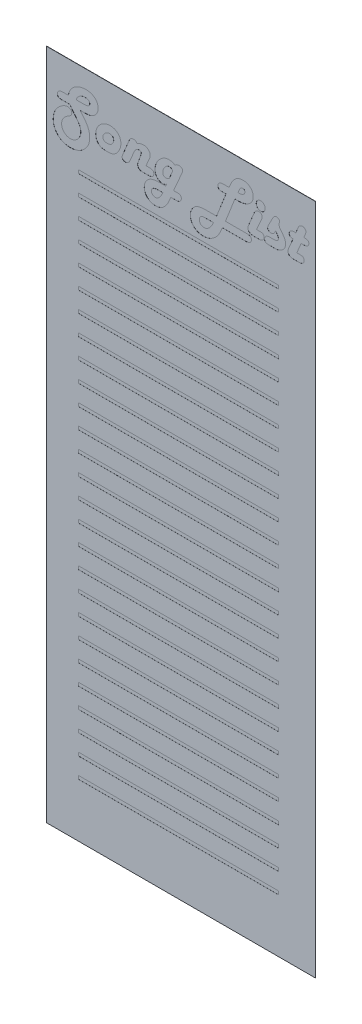
from build123d import *

# Parameters (mm, degrees)
SKETCH1_W           = 101.6
SKETCH1_H           = 254
BOSS_EXTRUDE1_DEPTH = 0.0762
SKETCH2_W           = 75.543719092
SKETCH2_H           = 1.27
CUT_EXTRUDE1_DEPTH  = 0.0254


with BuildPart() as part:
    # Sketch1 → Boss-Extrude1 (new body)
    with BuildSketch(Plane.XY):
        with Locations((50.8, 127)):
            Rectangle(SKETCH1_W, SKETCH1_H)
    extrude(amount=BOSS_EXTRUDE1_DEPTH)

    # Sketch2 → Cut-Extrude1 (cut)
    # profile 1 of 36: a face of its own
    with BuildSketch(Plane.XY.offset(0.0762)):
        with Locations((49.933239824, 211.380323937)):
            Rectangle(SKETCH2_W, SKETCH2_H)
    # profile 2 of 36: a face of its own
    with BuildSketch(Plane.XY.offset(0.0762)):
        with Locations((49.933239824, 219.000323937)):
            Rectangle(SKETCH2_W, SKETCH2_H)
    # profile 3 of 36: a face of its own
    with BuildSketch(Plane.XY.offset(0.0762)):
        with Locations((49.933239824, 203.760323937)):
            Rectangle(SKETCH2_W, SKETCH2_H)
    # profile 4 of 36: a face of its own
    with BuildSketch(Plane.XY.offset(0.0762)):
        with Locations((49.933239824, 196.140323937)):
            Rectangle(SKETCH2_W, SKETCH2_H)
    # profile 5 of 36: a face of its own
    with BuildSketch(Plane.XY.offset(0.0762)):
        with Locations((49.933239824, 188.520323937)):
            Rectangle(SKETCH2_W, SKETCH2_H)
    # profile 6 of 36: a face of its own
    with BuildSketch(Plane.XY.offset(0.0762)):
        with Locations((49.933239824, 180.900323937)):
            Rectangle(SKETCH2_W, SKETCH2_H)
    # profile 7 of 36: a face of its own
    with BuildSketch(Plane.XY.offset(0.0762)):
        with Locations((49.933239824, 173.280323937)):
            Rectangle(SKETCH2_W, SKETCH2_H)
    # profile 8 of 36: a face of its own
    with BuildSketch(Plane.XY.offset(0.0762)):
        with Locations((49.933239824, 165.660323937)):
            Rectangle(SKETCH2_W, SKETCH2_H)
    # profile 9 of 36: a face of its own
    with BuildSketch(Plane.XY.offset(0.0762)):
        with Locations((49.933239824, 158.040323937)):
            Rectangle(SKETCH2_W, SKETCH2_H)
    # profile 10 of 36: a face of its own
    with BuildSketch(Plane.XY.offset(0.0762)):
        with Locations((49.933239824, 150.420323937)):
            Rectangle(SKETCH2_W, SKETCH2_H)
    # profile 11 of 36: a face of its own
    with BuildSketch(Plane.XY.offset(0.0762)):
        with Locations((49.933239824, 142.800323937)):
            Rectangle(SKETCH2_W, SKETCH2_H)
    # profile 12 of 36: a face of its own
    with BuildSketch(Plane.XY.offset(0.0762)):
        with Locations((49.933239824, 135.180323937)):
            Rectangle(SKETCH2_W, SKETCH2_H)
    # profile 13 of 36: a face of its own
    with BuildSketch(Plane.XY.offset(0.0762)):
        with Locations((49.933239824, 127.560323937)):
            Rectangle(SKETCH2_W, SKETCH2_H)
    # profile 14 of 36: a face of its own
    with BuildSketch(Plane.XY.offset(0.0762)):
        with Locations((49.933239824, 119.940323937)):
            Rectangle(SKETCH2_W, SKETCH2_H)
    # profile 15 of 36: a face of its own
    with BuildSketch(Plane.XY.offset(0.0762)):
        with Locations((49.933239824, 112.320323937)):
            Rectangle(SKETCH2_W, SKETCH2_H)
    # profile 16 of 36: a face of its own
    with BuildSketch(Plane.XY.offset(0.0762)):
        with Locations((49.933239824, 104.700323937)):
            Rectangle(SKETCH2_W, SKETCH2_H)
    # profile 17 of 36: a face of its own
    with BuildSketch(Plane.XY.offset(0.0762)):
        with Locations((49.933239824, 97.080323937)):
            Rectangle(SKETCH2_W, SKETCH2_H)
    # profile 18 of 36: a face of its own
    with BuildSketch(Plane.XY.offset(0.0762)):
        with Locations((49.933239824, 89.460323937)):
            Rectangle(SKETCH2_W, SKETCH2_H)
    # profile 19 of 36: a face of its own
    with BuildSketch(Plane.XY.offset(0.0762)):
        with Locations((49.933239824, 81.840323937)):
            Rectangle(SKETCH2_W, SKETCH2_H)
    # profile 20 of 36: a face of its own
    with BuildSketch(Plane.XY.offset(0.0762)):
        with Locations((49.933239824, 74.220323937)):
            Rectangle(SKETCH2_W, SKETCH2_H)
    # profile 21 of 36: a face of its own
    with BuildSketch(Plane.XY.offset(0.0762)):
        with Locations((49.933239824, 66.600323937)):
            Rectangle(SKETCH2_W, SKETCH2_H)
    # profile 22 of 36: a face of its own
    with BuildSketch(Plane.XY.offset(0.0762)):
        with Locations((49.933239824, 58.980323937)):
            Rectangle(SKETCH2_W, SKETCH2_H)
    # profile 23 of 36: a face of its own
    with BuildSketch(Plane.XY.offset(0.0762)):
        with Locations((49.933239824, 51.360323937)):
            Rectangle(SKETCH2_W, SKETCH2_H)
    # profile 24 of 36: a face of its own
    with BuildSketch(Plane.XY.offset(0.0762)):
        with Locations((49.933239824, 43.740323937)):
            Rectangle(SKETCH2_W, SKETCH2_H)
    # profile 25 of 36: a face of its own
    with BuildSketch(Plane.XY.offset(0.0762)):
        with Locations((49.933239824, 36.120323937)):
            Rectangle(SKETCH2_W, SKETCH2_H)
    # profile 26 of 36: a face of its own
    with BuildSketch(Plane.XY.offset(0.0762)):
        with Locations((49.933239824, 28.500323937)):
            Rectangle(SKETCH2_W, SKETCH2_H)
    # profile 27 of 36: a face of its own
    with BuildSketch(Plane.XY.offset(0.0762)):
        with Locations((49.933239824, 20.880323937)):
            Rectangle(SKETCH2_W, SKETCH2_H)
    # profile 28 of 36: a face of its own
    with BuildSketch(Plane.XY.offset(0.0762)):
        with BuildLine():
            Line((12.799992108, 239.347419693), (13.899009659, 237.940959933))
            Line((13.899009659, 237.940959933), (14.531563169, 237.163519864))
            add(Edge.make_bspline(
                [(14.531563169, 237.163519864), (14.678267375, 236.972488698), (14.966937966, 236.596595728), (15.341376369, 236.00534523), (15.656433521, 235.404998945), (15.921631391, 234.799679598), (16.124086339, 234.183089813), (16.263229041, 233.557847822), (16.357860953, 232.925814207), (16.367729024, 232.500400005), (16.372682604, 232.286850344)],
                knots=[0, 0, 0, 0, 1.087213536, 2.139315444, 3.155259872, 4.146323933, 5.120225414, 6.080243713, 7.036319657, 8, 8, 8, 8], degree=3))
            add(Edge.make_bspline(
                [(16.372682604, 232.286850344), (16.36835068, 232.081628828), (16.359779243, 231.675563631), (16.278818722, 231.07731083), (16.152316005, 230.498946919), (15.975109766, 229.939945184), (15.743474483, 229.401357422), (15.463554822, 228.8810116), (15.134359827, 228.37780816), (14.877393692, 228.066344202), (14.747126097, 227.908449231)],
                knots=[0, 0, 0, 0, 1.031153094, 2.040309392, 3.028753844, 4.004416457, 4.983308086, 5.971486458, 6.971656013, 8, 8, 8, 8], degree=3))
            add(Edge.make_bspline(
                [(14.747126097, 227.908449231), (14.559474132, 227.702655651), (14.188650196, 227.295981595), (13.562853793, 226.768524375), (12.893621284, 226.325005016), (12.18461878, 225.955196809), (11.429102808, 225.673553763), (10.63141938, 225.473450616), (9.792211357, 225.344215104), (9.217188401, 225.331648526), (8.923393221, 225.325227912)],
                knots=[0, 0, 0, 0, 1.014361963, 2.004507103, 2.973878053, 3.936004283, 4.912953146, 5.905404457, 6.929813031, 8, 8, 8, 8], degree=3))
            add(Edge.make_bspline(
                [(8.923393221, 225.325227912), (8.695783163, 225.330586942), (8.25084507, 225.341062914), (7.59942141, 225.425200226), (6.978564695, 225.556928265), (6.389469186, 225.749346641), (5.831575512, 225.993708141), (5.304353377, 226.292916), (4.808881631, 226.646571882), (4.351287515, 227.053390189), (3.934758885, 227.49896482), (3.572510547, 227.983243593), (3.263544099, 228.49664037), (3.011688666, 229.040528045), (2.814896346, 229.614697382), (2.680414374, 230.220534234), (2.591808109, 230.855408231), (2.581765966, 231.288828962), (2.576655207, 231.509410275)],
                knots=[0, 0, 0, 0, 1.098721128, 2.147808791, 3.166400415, 4.159305812, 5.134755567, 6.102713917, 7.081309491, 8.068545344, 9.054600725, 10.021555836, 10.983378149, 11.942775527, 12.91049988, 13.908118797, 14.935376481, 16, 16, 16, 16], degree=3))
            add(Edge.make_bspline(
                [(2.576655207, 231.509410275), (2.583732104, 231.780984107), (2.597669113, 232.315812697), (2.740046685, 233.097328056), (2.952290284, 233.848011406), (3.264621017, 234.560498261), (3.658131334, 235.242693645), (4.1486542, 235.881070282), (4.716272314, 236.494492826), (5.151948976, 236.857273335), (5.375439453, 237.043370035)],
                knots=[0, 0, 0, 0, 1.012350536, 1.993689918, 2.954908396, 3.917623185, 4.88865083, 5.88644935, 6.915805033, 8, 8, 8, 8], degree=3))
            add(Edge.make_bspline(
                [(5.375439453, 237.043370035), (5.496733976, 237.136924235), (5.731893152, 237.318301992), (6.094343574, 237.555002087), (6.447970287, 237.757598978), (6.794084679, 237.925855572), (7.13420728, 238.052961615), (7.466017161, 238.146517711), (7.791548927, 238.206734639), (8.007889496, 238.213349014), (8.114148786, 238.216597775)],
                knots=[0, 0, 0, 0, 1.211496243, 2.34878256, 3.421462773, 4.434344698, 5.389824246, 6.289742663, 7.159978495, 8, 8, 8, 8], degree=3))
            add(Edge.make_bspline(
                [(8.114148786, 238.216597775), (8.218256396, 238.21196152), (8.419612883, 238.202994453), (8.705954674, 238.130835935), (8.963801673, 238.014094014), (9.182002339, 237.84529301), (9.364246572, 237.646015371), (9.495177012, 237.411644564), (9.575472211, 237.149871027), (9.583587931, 236.965031236), (9.587751097, 236.870212929)],
                knots=[0, 0, 0, 0, 1.115149443, 2.156831516, 3.145864946, 4.128667034, 5.094848421, 6.022437604, 6.985558699, 8, 8, 8, 8], degree=3))
            add(Edge.make_bspline(
                [(9.587751097, 236.870212929), (9.58550612, 236.803909444), (9.581040153, 236.672010943), (9.530451369, 236.480345808), (9.462475512, 236.293541274), (9.354038702, 236.117511011), (9.22179856, 235.945278265), (9.056017311, 235.782534376), (8.864587284, 235.625965563), (8.721755469, 235.5330796), (8.647755378, 235.48495608)],
                knots=[0, 0, 0, 0, 0.905632309, 1.801587702, 2.70029788, 3.618768585, 4.619014936, 5.668392158, 6.792011483, 8, 8, 8, 8], degree=3))
            Line((8.647755378, 235.48495608), (7.683022929, 234.891274573))
            add(Edge.make_bspline(
                [(7.683022929, 234.891274573), (7.546888498, 234.79967489), (7.273602252, 234.615790964), (6.914212103, 234.266573449), (6.577798169, 233.879295172), (6.291561923, 233.440418898), (6.049254852, 232.984045289), (5.871706886, 232.518325149), (5.765428401, 232.053711901), (5.750355979, 231.743150104), (5.742956577, 231.590688101)],
                knots=[0, 0, 0, 0, 0.988432046, 1.984251009, 3.012924967, 4.079661629, 5.138575426, 6.126265742, 7.080140308, 8, 8, 8, 8], degree=3))
            add(Edge.make_bspline(
                [(5.742956577, 231.590688101), (5.745144047, 231.472701504), (5.749448962, 231.240505296), (5.798994476, 230.901763813), (5.866306886, 230.577436921), (5.971552264, 230.271736083), (6.101563389, 229.979236403), (6.265494048, 229.704990291), (6.453997164, 229.443100747), (6.671642339, 229.202371589), (6.911388781, 228.982654887), (7.17043711, 228.792340824), (7.44329156, 228.62638297), (7.735987878, 228.498554528), (8.039057001, 228.388168431), (8.36174836, 228.321632375), (8.69802291, 228.271621155), (8.929076985, 228.267479865), (9.047076868, 228.265364898)],
                knots=[0, 0, 0, 0, 1.077506836, 2.12052054, 3.123651777, 4.100793165, 5.069355656, 6.044299951, 7.015551488, 8.014281989, 9.005030209, 9.982645996, 10.948331918, 11.916894409, 12.897529089, 13.890147529, 14.922493164, 16, 16, 16, 16], degree=3))
            add(Edge.make_bspline(
                [(9.047076868, 228.265364898), (9.177993517, 228.270001439), (9.436326197, 228.279150541), (9.817493637, 228.334968771), (10.18241484, 228.43642139), (10.536763578, 228.570353316), (10.876227293, 228.748524942), (11.201641403, 228.965736381), (11.516273701, 229.21884143), (11.810968669, 229.509534051), (12.085418614, 229.823102992), (12.323225257, 230.157698216), (12.525684251, 230.505346316), (12.69349803, 230.866688017), (12.820558619, 231.243944258), (12.911640546, 231.633235952), (12.971598908, 232.036451798), (12.977311579, 232.310191303), (12.980216851, 232.449405994)],
                knots=[0, 0, 0, 0, 0.988079025, 1.949737506, 2.898492785, 3.84106555, 4.803175793, 5.784354068, 6.789399104, 7.845390096, 8.903996503, 9.930047073, 10.937761348, 11.936022923, 12.931073945, 13.935765168, 14.950199696, 16, 16, 16, 16], degree=3))
            add(Edge.make_bspline(
                [(12.980216851, 232.449405994), (12.975385663, 232.624164239), (12.965886816, 232.967765417), (12.87274566, 233.470436919), (12.730384477, 233.950124901), (12.554296121, 234.333594636), (12.373062179, 234.642897515), (12.207846763, 234.908337092), (12.004181181, 235.201584333), (11.768017155, 235.52520161), (11.498226595, 235.879843819), (11.194776241, 236.263357494), (10.858164709, 236.67828547), (10.620038426, 236.962433212), (10.49594245, 237.110512587)],
                knots=[0, 0, 0, 0, 1.162130439, 2.284924465, 3.391170218, 4.485879898, 5.083016391, 5.777003495, 6.566473729, 7.458843396, 8.44366613, 9.532293729, 10.71399153, 12, 12, 12, 12], degree=3))
            add(Edge.make_bspline(
                [(10.49594245, 237.110512587), (10.326272593, 237.314792217), (10.003608929, 237.703273798), (9.58147449, 238.284899781), (9.222364337, 238.819773789), (9.035941939, 239.17846336), (8.94812995, 239.347419693)],
                knots=[0, 0, 0, 0, 1.168433099, 2.222026432, 3.162507306, 4, 4, 4, 4], degree=3))
            Line((8.94812995, 239.347419693), (5.728821303, 239.347419693))
            add(Edge.make_bspline(
                [(5.728821303, 239.347419693), (5.606135129, 239.350665327), (5.376125333, 239.356750183), (5.053769465, 239.404748764), (4.779414333, 239.486918331), (4.552231497, 239.604992954), (4.371587404, 239.758289821), (4.249824992, 239.954232608), (4.171823794, 240.179213412), (4.163925107, 240.340909035), (4.159805892, 240.425234333)],
                knots=[0, 0, 0, 0, 1.363150398, 2.555609448, 3.611533672, 4.531061041, 5.384561123, 6.208947295, 7.065954584, 8, 8, 8, 8], degree=3))
            add(Edge.make_bspline(
                [(4.159805892, 240.425234333), (4.165762438, 240.549824178), (4.177183795, 240.788718524), (4.287601344, 241.122832807), (4.464402085, 241.412448641), (4.717018168, 241.648241297), (5.028758082, 241.836187227), (5.399425719, 241.970198624), (5.825926192, 242.045475878), (6.127833879, 242.05589411), (6.287164625, 242.061392296)],
                knots=[0, 0, 0, 0, 0.982763483, 1.884396285, 2.750572256, 3.640234128, 4.589429985, 5.612361548, 6.739932005, 8, 8, 8, 8], degree=3))
            Line((6.287164625, 242.061392296), (8.329711714, 242.061392296))
            add(Edge.make_bspline(
                [(8.329711714, 242.061392296), (8.353895527, 242.245914998), (8.401678479, 242.610499323), (8.543809551, 243.138980915), (8.730221864, 243.646220434), (8.975225361, 244.12659243), (9.272536826, 244.581683031), (9.614611461, 245.016841873), (10.01947187, 245.418196799), (10.464557697, 245.798336502), (10.947983377, 246.141794382), (11.461832178, 246.44103066), (11.998649095, 246.694850693), (12.558336869, 246.905360716), (13.142365291, 247.062643169), (13.747741946, 247.181314708), (14.379319242, 247.247496901), (14.808234911, 247.257889479), (15.026297758, 247.263173118)],
                knots=[0, 0, 0, 0, 0.959214425, 1.895238577, 2.816367162, 3.743171911, 4.670295409, 5.617517851, 6.593016062, 7.606178587, 8.634807098, 9.647951395, 10.670096435, 11.695074032, 12.72859206, 13.786986644, 14.874893069, 16, 16, 16, 16], degree=3))
            add(Edge.make_bspline(
                [(15.026297758, 247.263173118), (15.188993394, 247.259727055), (15.506909599, 247.252993258), (15.97221187, 247.201911193), (16.416037972, 247.122588333), (16.836575179, 247.005081861), (17.235323731, 246.857901991), (17.60800728, 246.671673769), (17.958897498, 246.456410815), (18.284266942, 246.209983631), (18.575464593, 245.93412366), (18.83587995, 245.642213962), (19.053646202, 245.327499094), (19.231795436, 244.993145436), (19.369222276, 244.638158816), (19.469932243, 244.26412276), (19.525304234, 243.870002962), (19.534371005, 243.601119892), (19.538983974, 243.464318238)],
                knots=[0, 0, 0, 0, 1.180648015, 2.307051054, 3.39371816, 4.449541853, 5.472236417, 6.474024669, 7.468231969, 8.456613713, 9.430429231, 10.375483051, 11.290951775, 12.201255668, 13.11895744, 14.048058687, 15.00689619, 16, 16, 16, 16], degree=3))
            add(Edge.make_bspline(
                [(19.538983974, 243.464318238), (19.532955691, 243.282508136), (19.521209185, 242.928239169), (19.427013811, 242.41235182), (19.272094163, 241.92947241), (19.053449664, 241.479343637), (18.776514394, 241.060978933), (18.430104195, 240.680933183), (18.027591265, 240.32776149), (17.720692534, 240.130455222), (17.563579436, 240.029446662)],
                knots=[0, 0, 0, 0, 1.048291861, 2.042665783, 3.014017582, 3.965314096, 4.920872842, 5.897747433, 6.923777195, 8, 8, 8, 8], degree=3))
            add(Edge.make_bspline(
                [(17.563579436, 240.029446662), (17.464570215, 239.974117349), (17.257935573, 239.858643735), (16.910888193, 239.725085905), (16.526893706, 239.603637876), (16.09847653, 239.509938602), (15.631047856, 239.437281365), (15.121522743, 239.384624584), (14.572017164, 239.353057236), (14.191182322, 239.349340142), (13.994422758, 239.347419693)],
                knots=[0, 0, 0, 0, 0.740091575, 1.544589031, 2.423213768, 3.369711779, 4.405839984, 5.51227739, 6.714709999, 8, 8, 8, 8], degree=3))
            Line((13.994422758, 239.347419693), (12.799992108, 239.347419693))
        make_face()
        with BuildLine():
            Line((11.368795618, 242.061392296), (14.231188597, 242.061392296))
            add(Edge.make_bspline(
                [(14.231188597, 242.061392296), (14.398724155, 242.064745427), (14.71279348, 242.071031349), (15.150159753, 242.134895336), (15.52541308, 242.232850122), (15.833765722, 242.380283235), (16.078985861, 242.570806863), (16.249220771, 242.809450698), (16.359498702, 243.088951108), (16.368151042, 243.29123294), (16.372682604, 243.397175686)],
                knots=[0, 0, 0, 0, 1.41109015, 2.645289967, 3.717234895, 4.667460682, 5.507862867, 6.304241508, 7.111866301, 8, 8, 8, 8], degree=3))
            add(Edge.make_bspline(
                [(16.372682604, 243.397175686), (16.367822223, 243.480462557), (16.358286105, 243.643872234), (16.264897856, 243.874684626), (16.109382926, 244.073357301), (15.901231827, 244.243365444), (15.645500505, 244.377615932), (15.351548693, 244.484042731), (15.015130308, 244.536012657), (14.77906129, 244.544663358), (14.655246816, 244.549200515)],
                knots=[0, 0, 0, 0, 0.864343747, 1.695851118, 2.544822453, 3.468425866, 4.47297226, 5.539998438, 6.709768014, 8, 8, 8, 8], degree=3))
            add(Edge.make_bspline(
                [(14.655246816, 244.549200515), (14.455144659, 244.541473644), (14.060051709, 244.526217276), (13.48479141, 244.370055173), (12.934501559, 244.135384491), (12.514739205, 243.854757267), (12.199605927, 243.606647177), (11.995784756, 243.403397853), (11.816245335, 243.198296232), (11.667132278, 242.985027882), (11.544726945, 242.765686137), (11.456765807, 242.536923861), (11.394387264, 242.302228645), (11.377344395, 242.141842617), (11.368795618, 242.061392296)],
                knots=[0, 0, 0, 0, 1.603118089, 3.165286474, 4.753689676, 6.388057769, 7.201937501, 7.971062562, 8.695322866, 9.388017919, 10.056797037, 10.706649399, 11.351249784, 12, 12, 12, 12], degree=3))
        make_face(mode=Mode.SUBTRACT)
    # profile 29 of 36: a face of its own
    with BuildSketch(Plane.XY.offset(0.0762)):
        with BuildLine():
            add(Edge.make_bspline(
                [(24.157684745, 240.025912844), (24.299165323, 240.022282587), (24.577114066, 240.015150687), (24.9843582, 239.966109203), (25.371921376, 239.880167414), (25.740257459, 239.764274746), (26.089916992, 239.614836473), (26.420040559, 239.431161317), (26.728139268, 239.209169539), (27.016841111, 238.96074976), (27.276669823, 238.68477611), (27.510482958, 238.392404608), (27.698455623, 238.074630036), (27.86273856, 237.744947751), (27.979294617, 237.392963254), (28.069993052, 237.025936633), (28.123384881, 236.6397224), (28.129909051, 236.375639586), (28.133230549, 236.241193238)],
                knots=[0, 0, 0, 0, 1.104213352, 2.169306331, 3.195434986, 4.19857091, 5.178821508, 6.158425175, 7.140614008, 8.137834167, 9.126328083, 10.095565741, 11.052648781, 12.002506776, 12.964874201, 13.939330334, 14.950899116, 16, 16, 16, 16], degree=3))
            add(Edge.make_bspline(
                [(28.133230549, 236.241193238), (28.126643803, 236.033398771), (28.113416482, 235.616111679), (27.998354275, 234.993492456), (27.813022488, 234.37403468), (27.556946977, 233.768880773), (27.247400536, 233.192665653), (26.88444525, 232.671405211), (26.483691921, 232.204510039), (26.175624822, 231.944976679), (26.023540909, 231.816852484)],
                knots=[0, 0, 0, 0, 0.985302845, 1.978657876, 2.993696354, 4.048356841, 5.091281303, 6.091328202, 7.057743337, 8, 8, 8, 8], degree=3))
            add(Edge.make_bspline(
                [(26.023540909, 231.816852484), (25.919910154, 231.742040029), (25.716971229, 231.595535652), (25.397348962, 231.409752677), (25.070747179, 231.265454082), (24.730939195, 231.149924306), (24.352206722, 231.07311106), (23.918706697, 231.01922008), (23.41852417, 230.98335139), (23.063447451, 230.980729613), (22.874908632, 230.979337501)],
                knots=[0, 0, 0, 0, 0.921254077, 1.804081356, 2.659560611, 3.492177375, 4.386734262, 5.440228603, 6.640811263, 8, 8, 8, 8], degree=3))
            add(Edge.make_bspline(
                [(22.874908632, 230.979337501), (22.71821556, 230.980554124), (22.418808119, 230.982878833), (21.989711321, 231.004115417), (21.600499701, 231.038443797), (21.250062485, 231.08723493), (20.939000411, 231.148975517), (20.668381448, 231.226829862), (20.435274887, 231.315508308), (20.301424092, 231.394593977), (20.238680036, 231.431666268)],
                knots=[0, 0, 0, 0, 1.39041541, 2.656790854, 3.811370106, 4.856520238, 5.795436321, 6.622484863, 7.354274382, 8, 8, 8, 8], degree=3))
            add(Edge.make_bspline(
                [(20.238680036, 231.431666268), (20.111259073, 231.52274922), (19.859662794, 231.702595072), (19.532122685, 232.022826498), (19.251332557, 232.371325299), (19.028290117, 232.755254739), (18.849021962, 233.168581032), (18.722991576, 233.615303009), (18.647622113, 234.093600108), (18.638837476, 234.422173109), (18.63432644, 234.590900001)],
                knots=[0, 0, 0, 0, 1.013933406, 2.002040069, 2.958337914, 3.906370811, 4.870802342, 5.871308639, 6.906886819, 8, 8, 8, 8], degree=3))
            add(Edge.make_bspline(
                [(18.63432644, 234.590900001), (18.638667103, 234.771428336), (18.647276314, 235.129485657), (18.72851877, 235.656032885), (18.853574808, 236.165103259), (19.038088047, 236.652621879), (19.2661175, 237.124705131), (19.552841256, 237.574761041), (19.886525056, 238.008526244), (20.268405518, 238.416978523), (20.685033496, 238.791143374), (21.123628525, 239.124151027), (21.586187049, 239.397774213), (22.061294752, 239.632231341), (22.559367635, 239.809961597), (23.076690291, 239.930126864), (23.610789318, 240.013656984), (23.973597457, 240.02178747), (24.157684745, 240.025912844)],
                knots=[0, 0, 0, 0, 1.007797798, 1.998851768, 2.969155317, 3.931055872, 4.905122675, 5.892763132, 6.906173297, 7.958361136, 9.01137164, 10.031276384, 11.028840275, 12.008823124, 12.987014998, 13.974918451, 14.972482342, 16, 16, 16, 16], degree=3))
        make_face()
        with BuildLine():
            add(Edge.make_bspline(
                [(23.882046902, 237.311940241), (23.725493686, 237.303366609), (23.411783312, 237.286186269), (22.955322885, 237.136953579), (22.523169523, 236.892974205), (22.130363776, 236.565548942), (21.785071344, 236.192593022), (21.536244477, 235.777354651), (21.376694401, 235.341963682), (21.357731756, 235.040989928), (21.348299042, 234.891274573)],
                knots=[0, 0, 0, 0, 0.975909487, 1.955583772, 2.966800096, 4.059629033, 5.138097043, 6.124846471, 7.067230041, 8, 8, 8, 8], degree=3))
            add(Edge.make_bspline(
                [(21.348299042, 234.891274573), (21.35179096, 234.797443279), (21.358485209, 234.617562115), (21.444663786, 234.367731114), (21.575570065, 234.151281326), (21.769714694, 233.981012517), (22.011877857, 233.850966131), (22.304657343, 233.755526264), (22.64909607, 233.701278512), (22.895911388, 233.696072323), (23.026862827, 233.693310104)],
                knots=[0, 0, 0, 0, 0.956805885, 1.834263912, 2.674438196, 3.520051675, 4.443416229, 5.473475652, 6.659515948, 8, 8, 8, 8], degree=3))
            add(Edge.make_bspline(
                [(23.026862827, 233.693310104), (23.181770936, 233.698856547), (23.475771431, 233.709383155), (23.887844254, 233.802752359), (24.24971643, 233.950619104), (24.444500535, 234.105546102), (24.539337142, 234.180977056)],
                knots=[0, 0, 0, 0, 1.142903159, 2.169118812, 3.108579422, 4, 4, 4, 4], degree=3))
            add(Edge.make_bspline(
                [(24.539337142, 234.180977056), (24.608992697, 234.246835086), (24.746099092, 234.37646663), (24.924379503, 234.588431494), (25.079008616, 234.804793733), (25.203380006, 235.028816204), (25.300994497, 235.260792865), (25.365730155, 235.501197627), (25.411644816, 235.747088626), (25.416707362, 235.913512809), (25.419257947, 235.997359761)],
                knots=[0, 0, 0, 0, 1.104697038, 2.174428561, 3.188273473, 4.167300995, 5.123441968, 6.082569835, 7.033970464, 8, 8, 8, 8], degree=3))
            add(Edge.make_bspline(
                [(25.419257947, 235.997359761), (25.413468667, 236.090905983), (25.402190342, 236.273147101), (25.324489102, 236.533849278), (25.184742525, 236.762470978), (24.994909363, 236.956700466), (24.765773665, 237.115573462), (24.499291816, 237.230396923), (24.201553297, 237.30261066), (23.990849224, 237.308763215), (23.882046902, 237.311940241)],
                knots=[0, 0, 0, 0, 0.989535236, 1.927752973, 2.844622907, 3.796480395, 4.781690203, 5.774984966, 6.8510578, 8, 8, 8, 8], degree=3))
        make_face(mode=Mode.SUBTRACT)
    # profile 30 of 36: a face of its own
    with BuildSketch(Plane.XY.offset(0.0762)):
        with BuildLine():
            Line((37.639202296, 233.693310104), (39.070398786, 233.693310104))
            add(Edge.make_bspline(
                [(39.070398786, 233.693310104), (39.188445172, 233.690544481), (39.409415519, 233.685367526), (39.717242659, 233.63176331), (39.980080501, 233.54928989), (40.199877264, 233.429893718), (40.366834161, 233.26529335), (40.486593469, 233.068751791), (40.559900813, 232.837198406), (40.567989972, 232.671432597), (40.572271645, 232.583691097)],
                knots=[0, 0, 0, 0, 1.332122808, 2.493592963, 3.515972208, 4.433507962, 5.28966748, 6.131650501, 7.011063936, 8, 8, 8, 8], degree=3))
            add(Edge.make_bspline(
                [(40.572271645, 232.583691097), (40.567533717, 232.463798441), (40.558422064, 232.233229287), (40.449616583, 231.909973473), (40.281391772, 231.626073333), (40.042298997, 231.38943912), (39.744169937, 231.207887293), (39.397340292, 231.069599033), (38.998042019, 230.996026998), (38.716108561, 230.985070246), (38.56859656, 230.979337501)],
                knots=[0, 0, 0, 0, 0.989273959, 1.902502344, 2.790953609, 3.701572615, 4.657126097, 5.664420405, 6.777988174, 8, 8, 8, 8], degree=3))
            Line((38.56859656, 230.979337501), (36.077254522, 230.979337501))
            add(Edge.make_bspline(
                [(36.077254522, 230.979337501), (35.967172098, 230.98465517), (35.753241939, 230.994989335), (35.44696245, 231.078754322), (35.169241283, 231.216228883), (34.922855982, 231.401621219), (34.720395777, 231.631444411), (34.573574691, 231.894083067), (34.47924564, 232.185145597), (34.470398476, 232.389762263), (34.465833289, 232.495345635)],
                knots=[0, 0, 0, 0, 1.06919643, 2.077837253, 3.061385707, 4.06709547, 5.057357643, 6.016388657, 6.97644519, 8, 8, 8, 8], degree=3))
            add(Edge.make_bspline(
                [(34.465833289, 232.495345635), (34.469718606, 232.569826221), (34.478438876, 232.736991691), (34.543404713, 233.008571484), (34.629177185, 233.331853688), (34.711248305, 233.559610052), (34.755606406, 233.682708648)],
                knots=[0, 0, 0, 0, 0.728058364, 1.634066332, 2.72125148, 4, 4, 4, 4], degree=3))
            Line((34.755606406, 233.682708648), (35.667331577, 236.219990327))
            add(Edge.make_bspline(
                [(35.667331577, 236.219990327), (35.710437554, 236.338893266), (35.786162786, 236.547772712), (35.811783333, 236.768196128), (35.82281959, 236.863145292)],
                knots=[0, 0, 0, 0, 1.138483872, 2, 2, 2, 2], degree=3))
            add(Edge.make_bspline(
                [(35.82281959, 236.863145292), (35.82136903, 236.908186052), (35.818522341, 236.996577442), (35.777531511, 237.126277499), (35.701759349, 237.244199458), (35.593017687, 237.343922217), (35.468624091, 237.434907264), (35.318660634, 237.492693081), (35.154909227, 237.53483697), (35.038621422, 237.536987779), (34.978236971, 237.538104624)],
                knots=[0, 0, 0, 0, 0.891014791, 1.748594775, 2.662913937, 3.638243733, 4.662752758, 5.700245863, 6.805812943, 8, 8, 8, 8], degree=3))
            add(Edge.make_bspline(
                [(34.978236971, 237.538104624), (34.879940689, 237.532367781), (34.683517918, 237.520904005), (34.396965341, 237.437055051), (34.126678984, 237.295360369), (33.874966595, 237.096350579), (33.635465891, 236.846531035), (33.419317072, 236.536851117), (33.207450395, 236.179814626), (33.091750835, 235.914042619), (33.031102981, 235.774729196)],
                knots=[0, 0, 0, 0, 0.844704782, 1.68795045, 2.544298561, 3.454102781, 4.435689125, 5.509683468, 6.694616022, 8, 8, 8, 8], degree=3))
            Line((33.031102981, 235.774729196), (31.645846132, 232.481210361))
            add(Edge.make_bspline(
                [(31.645846132, 232.481210361), (31.593086233, 232.362102214), (31.492339224, 232.134660733), (31.306391013, 231.828068075), (31.105020984, 231.565610508), (30.881739354, 231.35110608), (30.636961168, 231.184292941), (30.372287566, 231.067266287), (30.089013513, 230.993550556), (29.89352146, 230.98412821), (29.794125241, 230.979337501)],
                knots=[0, 0, 0, 0, 1.228540311, 2.345943872, 3.375718969, 4.343035516, 5.255843253, 6.156722805, 7.062801887, 8, 8, 8, 8], degree=3))
            add(Edge.make_bspline(
                [(29.794125241, 230.979337501), (29.712495135, 230.982195386), (29.554168207, 230.987738441), (29.326223427, 231.046454718), (29.118961293, 231.143955007), (28.9328295, 231.272082963), (28.778729067, 231.431438243), (28.668715526, 231.614251475), (28.595861041, 231.813911135), (28.589033749, 231.954037161), (28.585559316, 232.025347775)],
                knots=[0, 0, 0, 0, 1.09983931, 2.133210258, 3.150310513, 4.177917642, 5.167433365, 6.116266512, 7.041361585, 8, 8, 8, 8], degree=3))
            add(Edge.make_bspline(
                [(28.585559316, 232.025347775), (28.587246714, 232.082125653), (28.590833281, 232.202807105), (28.636015429, 232.388314052), (28.689386931, 232.593422161), (28.746287384, 232.730355449), (28.776385515, 232.802787844)],
                knots=[0, 0, 0, 0, 0.84408435, 1.794102367, 2.833165756, 4, 4, 4, 4], degree=3))
            Line((28.776385515, 232.802787844), (28.907136799, 233.11729769))
            Line((28.907136799, 233.11729769), (31.306599556, 238.898624744))
            add(Edge.make_bspline(
                [(31.306599556, 238.898624744), (31.347013321, 238.987960979), (31.424759977, 239.159823051), (31.569293911, 239.392640321), (31.738864506, 239.586690045), (31.926987272, 239.748331311), (32.138695141, 239.873811449), (32.370669248, 239.961757458), (32.622161921, 240.016758978), (32.796399827, 240.02279921), (32.886216423, 240.025912844)],
                knots=[0, 0, 0, 0, 1.133500777, 2.180591034, 3.155994585, 4.103301528, 5.037982408, 5.986855797, 6.962259347, 8, 8, 8, 8], degree=3))
            add(Edge.make_bspline(
                [(32.886216423, 240.025912844), (32.959480127, 240.024676332), (33.102421043, 240.022263841), (33.307198673, 239.980450632), (33.49914155, 239.922363047), (33.671615468, 239.832119087), (33.83028969, 239.722278216), (33.970155633, 239.584302454), (34.09370252, 239.422253899), (34.159968628, 239.300103408), (34.193729265, 239.23787132)],
                knots=[0, 0, 0, 0, 1.084507589, 2.115925057, 3.08838965, 4.049487383, 4.989875946, 5.941237156, 6.951120778, 8, 8, 8, 8], degree=3))
            add(Edge.make_bspline(
                [(34.193729265, 239.23787132), (34.40164789, 239.35929697), (34.801224845, 239.592652167), (35.426214956, 239.834237947), (36.032554242, 239.995933517), (36.435577926, 240.016087281), (36.632064025, 240.025912844)],
                knots=[0, 0, 0, 0, 1.112280528, 2.137575052, 3.092012134, 4, 4, 4, 4], degree=3))
            add(Edge.make_bspline(
                [(36.632064025, 240.025912844), (36.811750105, 240.018757542), (37.158463929, 240.004951007), (37.654218886, 239.890181929), (38.101449165, 239.698207239), (38.48806695, 239.427906604), (38.813286145, 239.108103921), (39.045632289, 238.73232492), (39.191316323, 238.315343397), (39.207163545, 238.021090169), (39.215285344, 237.870283563)],
                knots=[0, 0, 0, 0, 1.147170408, 2.213526172, 3.231603276, 4.238037155, 5.212112722, 6.124927346, 7.039013623, 8, 8, 8, 8], degree=3))
            add(Edge.make_bspline(
                [(39.215285344, 237.870283563), (39.211456303, 237.781717895), (39.203540236, 237.598619339), (39.15017053, 237.31842822), (39.070806348, 237.023962883), (38.991324552, 236.829405818), (38.950248957, 236.72886019)],
                knots=[0, 0, 0, 0, 0.901170678, 1.863058847, 2.895644873, 4, 4, 4, 4], degree=3))
            Line((38.950248957, 236.72886019), (37.639202296, 233.693310104))
        make_face()
    # profile 31 of 36: a face of its own
    with BuildSketch(Plane.XY.offset(0.0762)):
        with BuildLine():
            Line((48.039230121, 230.753173118), (49.470426611, 230.753173118))
            add(Edge.make_bspline(
                [(49.470426611, 230.753173118), (49.588346952, 230.749809532), (49.808885551, 230.74351884), (50.11953603, 230.697040099), (50.381019209, 230.608139686), (50.603220383, 230.493867918), (50.77010842, 230.332310542), (50.8909894, 230.138547464), (50.962947957, 229.908711288), (50.971392098, 229.74420918), (50.975833289, 229.657689385)],
                knots=[0, 0, 0, 0, 1.336413946, 2.499406429, 3.541962258, 4.455946956, 5.30558417, 6.138919368, 7.021165637, 8, 8, 8, 8], degree=3))
            add(Edge.make_bspline(
                [(50.975833289, 229.657689385), (50.971029545, 229.536663377), (50.961789831, 229.303877075), (50.854177056, 228.977677553), (50.683930946, 228.692707001), (50.446175402, 228.453198432), (50.147936577, 228.266244808), (49.799168963, 228.131028118), (49.399442866, 228.055075158), (49.117373087, 228.044681553), (48.968624385, 228.039200515)],
                knots=[0, 0, 0, 0, 0.99397471, 1.911851028, 2.795840209, 3.708775585, 4.664719047, 5.675986474, 6.774438031, 8, 8, 8, 8], degree=3))
            Line((48.968624385, 228.039200515), (46.989686029, 228.039200515))
            Line((46.989686029, 228.039200515), (46.491417621, 226.820033135))
            add(Edge.make_bspline(
                [(46.491417621, 226.820033135), (46.41518783, 226.640314381), (46.266332051, 226.289373172), (46.021992299, 225.784667521), (45.761956499, 225.316522526), (45.487620694, 224.883668223), (45.206917797, 224.48117641), (44.905555831, 224.118302784), (44.594601928, 223.788235612), (44.27091661, 223.491336077), (43.932099562, 223.231317427), (43.58209196, 223.001262016), (43.214270184, 222.816844654), (42.840294227, 222.653337623), (42.44861017, 222.534091464), (42.043932301, 222.450409859), (41.626877665, 222.39482381), (41.343999417, 222.388354567), (41.201291337, 222.385090926)],
                knots=[0, 0, 0, 0, 1.271623137, 2.483129609, 3.65107976, 4.758150817, 5.820599307, 6.845383779, 7.827894673, 8.773045122, 9.703185751, 10.607810955, 11.4967092, 12.380391777, 13.263907744, 14.157892432, 15.070682757, 16, 16, 16, 16], degree=3))
            add(Edge.make_bspline(
                [(41.201291337, 222.385090926), (41.052700119, 222.388347444), (40.760434966, 222.394752714), (40.332416015, 222.449259373), (39.92216019, 222.535877543), (39.533287847, 222.666097746), (39.159001147, 222.822391042), (38.809120784, 223.02427472), (38.473126367, 223.253911976), (38.162936214, 223.520554986), (37.879341211, 223.813393554), (37.632709204, 224.127708105), (37.420178957, 224.458935615), (37.251684373, 224.811262712), (37.115542842, 225.179912162), (37.020870204, 225.567526104), (36.962540301, 225.97248048), (36.95664125, 226.248531743), (36.953641508, 226.388907279)],
                knots=[0, 0, 0, 0, 1.092561572, 2.148967347, 3.168634876, 4.171450916, 5.161231564, 6.146717638, 7.136915347, 8.150935136, 9.149738171, 10.130796101, 11.085050351, 12.038320732, 12.997674836, 13.970626457, 14.96803806, 16, 16, 16, 16], degree=3))
            add(Edge.make_bspline(
                [(36.953641508, 226.388907279), (36.9598596, 226.573271213), (36.972170468, 226.938283569), (37.088709452, 227.475015422), (37.268076042, 227.995425871), (37.524757476, 228.491415545), (37.838841807, 228.957932113), (38.218799464, 229.371846268), (38.644831351, 229.744287527), (38.967121968, 229.942441857), (39.1304737, 230.042875601)],
                knots=[0, 0, 0, 0, 0.991899155, 1.96380842, 2.945117492, 3.949701631, 4.963442207, 5.965216876, 6.968678171, 8, 8, 8, 8], degree=3))
            add(Edge.make_bspline(
                [(39.1304737, 230.042875601), (39.237990711, 230.099981903), (39.457025139, 230.216319273), (39.809197185, 230.361435822), (40.189814055, 230.479300377), (40.594972337, 230.582929521), (41.028422647, 230.660563266), (41.489028552, 230.710333978), (41.975738906, 230.748760896), (42.309649378, 230.751679482), (42.480533632, 230.753173118)],
                knots=[0, 0, 0, 0, 0.843727831, 1.7188484, 2.635766498, 3.604366414, 4.616802919, 5.685548693, 6.815540938, 8, 8, 8, 8], degree=3))
            Line((42.480533632, 230.753173118), (45.046085858, 230.753173118))
            Line((45.046085858, 230.753173118), (45.417136799, 231.573019008))
            add(Edge.make_bspline(
                [(45.417136799, 231.573019008), (45.293310002, 231.483512695), (45.057043827, 231.312731293), (44.6852811, 231.123772699), (44.320541079, 231.005007765), (44.078609262, 230.987724699), (43.96120358, 230.979337501)],
                knots=[0, 0, 0, 0, 1.145249851, 2.185179677, 3.119296423, 4, 4, 4, 4], degree=3))
            add(Edge.make_bspline(
                [(43.96120358, 230.979337501), (43.853929614, 230.982364654), (43.644548519, 230.988273159), (43.338277143, 231.02524292), (43.04930219, 231.098972193), (42.774414608, 231.193169014), (42.512575686, 231.312437935), (42.272461114, 231.467791475), (42.043879331, 231.644822721), (41.833596185, 231.849157186), (41.642691369, 232.075036558), (41.476468345, 232.318732891), (41.336090816, 232.580396876), (41.226533977, 232.859220089), (41.130476169, 233.151784649), (41.068776259, 233.462577657), (41.03404647, 233.79028293), (41.027798964, 234.013624854), (41.024600412, 234.127969779)],
                knots=[0, 0, 0, 0, 1.063717372, 2.076200937, 3.050520727, 4.01442721, 4.9548447, 5.8943917, 6.842823333, 7.817353053, 8.795235523, 9.770184967, 10.736705295, 11.732072933, 12.736646084, 13.785581265, 14.86627849, 16, 16, 16, 16], degree=3))
            add(Edge.make_bspline(
                [(41.024600412, 234.127969779), (41.028979032, 234.314375814), (41.037691934, 234.68530033), (41.119126081, 235.232877952), (41.244557863, 235.767501452), (41.429531431, 236.284585515), (41.652097234, 236.793530124), (41.940834395, 237.281820505), (42.27187015, 237.759525002), (42.650413745, 238.214666911), (43.062576769, 238.631942108), (43.488198853, 239.006347475), (43.930984939, 239.319362107), (44.383306003, 239.581085906), (44.852866119, 239.779265695), (45.332759565, 239.921466272), (45.824968171, 240.010046507), (46.157695319, 240.020597233), (46.325328152, 240.025912844)],
                knots=[0, 0, 0, 0, 1.025438348, 2.040493078, 3.040674177, 4.043394956, 5.059194893, 6.093430192, 7.160022835, 8.255835146, 9.347034138, 10.385771512, 11.371643616, 12.327046569, 13.256736695, 14.169657829, 15.077846677, 16, 16, 16, 16], degree=3))
            add(Edge.make_bspline(
                [(46.325328152, 240.025912844), (46.445621264, 240.0247408), (46.678651883, 240.022470329), (47.016143082, 239.980382488), (47.331230337, 239.922963035), (47.622768038, 239.838236285), (47.890514264, 239.727890266), (48.135389889, 239.593862859), (48.358035607, 239.433969725), (48.487154369, 239.307897171), (48.551633803, 239.244938957)],
                knots=[0, 0, 0, 0, 1.188834761, 2.302998858, 3.358612853, 4.35400679, 5.299469543, 6.217177408, 7.109692597, 8, 8, 8, 8], degree=3))
            add(Edge.make_bspline(
                [(48.551633803, 239.244938957), (48.600858956, 239.307429494), (48.697553502, 239.43018166), (48.865765141, 239.591291408), (49.049970968, 239.724610606), (49.247044787, 239.837027236), (49.461194906, 239.922301923), (49.690828174, 239.979586237), (49.934137912, 240.02249624), (50.101597623, 240.024751847), (50.187791765, 240.025912844)],
                knots=[0, 0, 0, 0, 1.011180621, 1.986294503, 2.95145444, 3.89757953, 4.86599152, 5.87283205, 6.905113257, 8, 8, 8, 8], degree=3))
            add(Edge.make_bspline(
                [(50.187791765, 240.025912844), (50.270475354, 240.021279406), (50.43193953, 240.012231248), (50.666918707, 239.957655492), (50.877323693, 239.849980653), (51.067291026, 239.714527307), (51.225761913, 239.550977681), (51.342980339, 239.364944934), (51.418037858, 239.160969072), (51.424770958, 239.017049091), (51.428162056, 238.944564385)],
                knots=[0, 0, 0, 0, 1.088136942, 2.124909398, 3.143121748, 4.174791491, 5.182584649, 6.115087106, 7.050671374, 8, 8, 8, 8], degree=3))
            add(Edge.make_bspline(
                [(51.428162056, 238.944564385), (51.422632144, 238.877205748), (51.410174245, 238.725458846), (51.349616113, 238.47482874), (51.243023445, 238.17982423), (51.156874431, 237.967726966), (51.110118392, 237.85261447)],
                knots=[0, 0, 0, 0, 0.708772025, 1.596735976, 2.695665774, 4, 4, 4, 4], degree=3))
            Line((51.110118392, 237.85261447), (48.039230121, 230.753173118))
        make_face()
        with BuildLine():
            Line((46.47021471, 234.096165412), (47.459683888, 236.44615471))
            add(Edge.make_bspline(
                [(47.459683888, 236.44615471), (47.495044845, 236.535717171), (47.557234133, 236.693230602), (47.575491392, 236.861311785), (47.583367536, 236.933821662)],
                knots=[0, 0, 0, 0, 1.137204112, 2, 2, 2, 2], degree=3))
            add(Edge.make_bspline(
                [(47.583367536, 236.933821662), (47.578945877, 236.990797493), (47.570127193, 237.104431737), (47.509385122, 237.267507888), (47.399167109, 237.408499297), (47.259906581, 237.534080546), (47.08830139, 237.637175198), (46.892826563, 237.709541602), (46.67636119, 237.758391175), (46.524692095, 237.762252372), (46.445477981, 237.764269008)],
                knots=[0, 0, 0, 0, 0.874832647, 1.744791537, 2.623727024, 3.596958916, 4.611167724, 5.675877722, 6.786151599, 8, 8, 8, 8], degree=3))
            add(Edge.make_bspline(
                [(46.445477981, 237.764269008), (46.372195028, 237.761831131), (46.225344895, 237.756945921), (46.006600118, 237.707856157), (45.79175153, 237.630490879), (45.579393411, 237.520546384), (45.367719173, 237.384665869), (45.163298612, 237.210714932), (44.956663504, 237.013359861), (44.695646086, 236.711513347), (44.404271211, 236.310349874), (44.156805999, 235.791167625), (43.991709998, 235.259377923), (43.973718894, 234.895992468), (43.964737399, 234.714583648)],
                knots=[0, 0, 0, 0, 0.616309761, 1.235009872, 1.878272608, 2.534859216, 3.244735686, 3.991563209, 4.791327615, 5.648922023, 7.349852037, 8.947072171, 10.475921292, 12, 12, 12, 12], degree=3))
            add(Edge.make_bspline(
                [(43.964737399, 234.714583648), (43.9672884, 234.616498565), (43.972072259, 234.43256092), (44.029195146, 234.174695148), (44.124465805, 233.955504514), (44.256504738, 233.772797157), (44.431528569, 233.633288925), (44.64304354, 233.534304032), (44.892624614, 233.479508334), (45.06937926, 233.471417503), (45.162701868, 233.46714572)],
                knots=[0, 0, 0, 0, 1.186495327, 2.225018834, 3.176896967, 4.064463073, 4.926897691, 5.858779561, 6.869482189, 8, 8, 8, 8], degree=3))
            add(Edge.make_bspline(
                [(45.162701868, 233.46714572), (45.245237576, 233.469295616), (45.402583253, 233.473394168), (45.627815983, 233.501013138), (45.83003854, 233.549312258), (46.007687431, 233.619177144), (46.159896645, 233.709555166), (46.289511371, 233.817082363), (46.399391867, 233.94425774), (46.446515193, 234.045332399), (46.47021471, 234.096165412)],
                knots=[0, 0, 0, 0, 1.285201238, 2.450101465, 3.526738295, 4.514548749, 5.411115634, 6.27070451, 7.130293387, 8, 8, 8, 8], degree=3))
        make_face(mode=Mode.SUBTRACT)
        with BuildLine():
            Line((43.98594031, 228.039200515), (41.92219031, 228.039200515))
            add(Edge.make_bspline(
                [(41.92219031, 228.039200515), (41.753374059, 228.034091129), (41.43242913, 228.024377424), (40.981150032, 227.943935886), (40.586715547, 227.81202993), (40.258040759, 227.619782655), (39.990633615, 227.38125917), (39.802667036, 227.087966596), (39.683731877, 226.751093086), (39.673110439, 226.510087702), (39.667614111, 226.38537346)],
                knots=[0, 0, 0, 0, 1.283469463, 2.440067309, 3.474505531, 4.430470728, 5.318408363, 6.173449629, 7.054805991, 8, 8, 8, 8], degree=3))
            add(Edge.make_bspline(
                [(39.667614111, 226.38537346), (39.671728834, 226.298702699), (39.679800314, 226.128688495), (39.763345315, 225.885725255), (39.892332299, 225.663109667), (40.069328265, 225.466139874), (40.283510132, 225.305048546), (40.525319605, 225.185657871), (40.791920309, 225.112846101), (40.978196042, 225.103746947), (41.074073871, 225.099063529)],
                knots=[0, 0, 0, 0, 0.978344728, 1.919130499, 2.875582257, 3.877119267, 4.896359027, 5.892729309, 6.915368433, 8, 8, 8, 8], degree=3))
            add(Edge.make_bspline(
                [(41.074073871, 225.099063529), (41.213910665, 225.107512415), (41.48948861, 225.124162731), (41.888705587, 225.248682371), (42.254141507, 225.460989265), (42.53387862, 225.697731513), (42.747583191, 225.932037506), (42.913753376, 226.141987799), (43.086544524, 226.381447118), (43.255929164, 226.65464905), (43.440100815, 226.953942138), (43.614499218, 227.29081329), (43.807079322, 227.650996378), (43.924847493, 227.906603214), (43.98594031, 228.039200515)],
                knots=[0, 0, 0, 0, 1.14824174, 2.262852927, 3.398785567, 4.601132324, 5.258865958, 6.002724448, 6.800623515, 7.684190848, 8.643824634, 9.687660727, 10.80046265, 12, 12, 12, 12], degree=3))
        make_face(mode=Mode.SUBTRACT)
    # profile 32 of 36: a face of its own
    with BuildSketch(Plane.XY.offset(0.0762)):
        with BuildLine():
            Line((71.192808888, 239.573584077), (67.613050755, 230.527008734))
            Line((67.613050755, 230.527008734), (75.87865221, 230.527008734))
            add(Edge.make_bspline(
                [(75.87865221, 230.527008734), (76.00015475, 230.523689567), (76.228975, 230.517438731), (76.549078316, 230.470047974), (76.822842515, 230.387438422), (77.047161544, 230.266581179), (77.225315771, 230.111481753), (77.348027606, 229.915890131), (77.424855979, 229.687957758), (77.432881733, 229.524050107), (77.437066166, 229.438592638)],
                knots=[0, 0, 0, 0, 1.350698466, 2.543709472, 3.587624918, 4.51380424, 5.357898689, 6.182666446, 7.052486414, 8, 8, 8, 8], degree=3))
            add(Edge.make_bspline(
                [(77.437066166, 229.438592638), (77.430548736, 229.316547552), (77.41801615, 229.081862924), (77.313799698, 228.748611939), (77.130444225, 228.463374121), (76.882622008, 228.221557156), (76.568322682, 228.041035947), (76.204063156, 227.90293133), (75.783737335, 227.829681465), (75.486645264, 227.818760745), (75.330910344, 227.813036131)],
                knots=[0, 0, 0, 0, 0.973732692, 1.872423554, 2.752146363, 3.65712048, 4.610825209, 5.626220251, 6.755670595, 8, 8, 8, 8], degree=3))
            Line((75.330910344, 227.813036131), (66.457492108, 227.813036131))
            Line((66.457492108, 227.813036131), (66.316139368, 227.473789556))
            add(Edge.make_bspline(
                [(66.316139368, 227.473789556), (66.249681992, 227.321525993), (66.121449552, 227.027726728), (65.925472314, 226.608985972), (65.74629848, 226.222752182), (65.577123967, 225.872606087), (65.417046058, 225.559222525), (65.274376331, 225.277523605), (65.135236283, 225.035630517), (64.970993931, 224.753057113), (64.746674867, 224.431940951), (64.458127138, 224.054687469), (64.128481238, 223.687324222), (63.887511817, 223.454385398), (63.764722416, 223.335688101)],
                knots=[0, 0, 0, 0, 1.220081646, 2.354201376, 3.395285381, 4.347103349, 5.209874728, 5.97987153, 6.66554993, 7.259018145, 8.379594869, 9.538971837, 10.745948036, 12, 12, 12, 12], degree=3))
            add(Edge.make_bspline(
                [(63.764722416, 223.335688101), (63.598859892, 223.187661004), (63.271691549, 222.895673527), (62.743073037, 222.51793632), (62.196229626, 222.198107075), (61.632741936, 221.934205803), (61.04858194, 221.731708041), (60.446094595, 221.587841929), (59.825021075, 221.495302355), (59.404317344, 221.485421095), (59.191961286, 221.480433392)],
                knots=[0, 0, 0, 0, 1.054295471, 2.079626522, 3.076624699, 4.056889846, 5.027353376, 6.004809826, 6.992900013, 8, 8, 8, 8], degree=3))
            add(Edge.make_bspline(
                [(59.191961286, 221.480433392), (59.021037562, 221.485064745), (58.685321916, 221.494161304), (58.192769451, 221.54910793), (57.725329003, 221.650084471), (57.279062678, 221.782739664), (56.857176909, 221.961287403), (56.457585365, 222.177151264), (56.07863617, 222.429731338), (55.729173163, 222.721000694), (55.410360594, 223.042536579), (55.131128591, 223.387671112), (54.895079928, 223.75502101), (54.704449765, 224.14345508), (54.549026632, 224.551755372), (54.44605549, 224.984250321), (54.379693504, 225.436250395), (54.37214404, 225.744332045), (54.368299042, 225.901240327)],
                knots=[0, 0, 0, 0, 1.119940144, 2.199703013, 3.241028362, 4.249257762, 5.245364437, 6.236346163, 7.220906871, 8.223806074, 9.211507142, 10.182914614, 11.12696175, 12.065694901, 13.013173859, 13.982709668, 14.972578996, 16, 16, 16, 16], degree=3))
            add(Edge.make_bspline(
                [(54.368299042, 225.901240327), (54.374749071, 226.098460318), (54.387558152, 226.490118517), (54.500968267, 227.066708381), (54.687153696, 227.622699125), (54.940258898, 228.153668672), (55.255119977, 228.647298174), (55.630773122, 229.084489183), (56.052984186, 229.470915044), (56.373368808, 229.675119558), (56.534529779, 229.777839214)],
                knots=[0, 0, 0, 0, 1.018464048, 2.022562684, 3.023611728, 4.042002998, 5.055195335, 6.039707465, 7.013926927, 8, 8, 8, 8], degree=3))
            add(Edge.make_bspline(
                [(56.534529779, 229.777839214), (56.646575149, 229.838860602), (56.875115398, 229.963326641), (57.245271065, 230.113470852), (57.643745281, 230.240449412), (58.069830382, 230.346082007), (58.525746201, 230.426362712), (59.009226149, 230.486403871), (59.522421504, 230.52203497), (59.873931309, 230.525322587), (60.054212998, 230.527008734)],
                knots=[0, 0, 0, 0, 0.841061203, 1.715522346, 2.62964814, 3.598321595, 4.608849343, 5.681545143, 6.810915222, 8, 8, 8, 8], degree=3))
            Line((60.054212998, 230.527008734), (64.262990823, 230.527008734))
            Line((64.262990823, 230.527008734), (67.828613683, 239.573584077))
            Line((67.828613683, 239.573584077), (66.397417193, 239.573584077))
            Line((66.397417193, 239.573584077), (66.07583971, 239.573584077))
            add(Edge.make_bspline(
                [(66.07583971, 239.573584077), (65.974265052, 239.576511957), (65.782505855, 239.5820394), (65.51386544, 239.634949539), (65.283094843, 239.72135664), (65.094205687, 239.847133121), (64.945880373, 240.008923535), (64.843538277, 240.207652502), (64.782636668, 240.441743062), (64.775602201, 240.60859346), (64.771860686, 240.697338357)],
                knots=[0, 0, 0, 0, 1.237003005, 2.335294124, 3.321929172, 4.222008015, 5.075885706, 5.968719178, 6.919596167, 8, 8, 8, 8], degree=3))
            add(Edge.make_bspline(
                [(64.771860686, 240.697338357), (64.777770434, 240.814905371), (64.789221509, 241.042710136), (64.903606175, 241.362859235), (65.091303968, 241.640066592), (65.346783501, 241.874767551), (65.666840146, 242.063193306), (66.044962193, 242.195094573), (66.477967674, 242.272089133), (66.783444991, 242.282202728), (66.94515906, 242.287556679)],
                knots=[0, 0, 0, 0, 0.929189476, 1.800452212, 2.655142974, 3.560373865, 4.527681494, 5.579218059, 6.718482606, 8, 8, 8, 8], degree=3))
            Line((66.94515906, 242.287556679), (68.987706149, 242.287556679))
            Line((68.987706149, 242.287556679), (69.535448015, 243.573866611))
            add(Edge.make_bspline(
                [(69.535448015, 243.573866611), (69.60104071, 243.723020693), (69.730058744, 244.016400414), (69.945843004, 244.434538183), (70.170845621, 244.827556181), (70.416954591, 245.184946862), (70.664979089, 245.522075981), (70.937279273, 245.820972836), (71.214030566, 246.097854059), (71.506375328, 246.345001483), (71.813547889, 246.557910597), (72.130474036, 246.749612229), (72.462844772, 246.906479277), (72.80678671, 247.040254093), (73.165397474, 247.136119701), (73.534143373, 247.213183158), (73.917589864, 247.255006415), (74.177616758, 247.260423017), (74.309636799, 247.263173118)],
                knots=[0, 0, 0, 0, 1.21446088, 2.388792767, 3.506393537, 4.587837487, 5.622337743, 6.623653816, 7.598590186, 8.539717348, 9.472820764, 10.382488244, 11.297691834, 12.209391714, 13.129804915, 14.06154363, 15.015812992, 16, 16, 16, 16], degree=3))
            add(Edge.make_bspline(
                [(74.309636799, 247.263173118), (74.442890631, 247.260867246), (74.704341142, 247.256343013), (75.088562356, 247.208552019), (75.455812031, 247.132833678), (75.804921817, 247.020580501), (76.13861297, 246.884113789), (76.454801166, 246.71341224), (76.751842313, 246.510564338), (77.03082232, 246.282137295), (77.282930155, 246.028980202), (77.507174696, 245.760588814), (77.697213023, 245.475759583), (77.84826166, 245.173260512), (77.970895439, 244.856823167), (78.054722295, 244.523329083), (78.104907446, 244.174967202), (78.111972073, 243.938017374), (78.115559316, 243.817700087)],
                knots=[0, 0, 0, 0, 1.11481431, 2.187319989, 3.235392645, 4.24880669, 5.252195277, 6.249169264, 7.250035794, 8.258690534, 9.262611821, 10.235903678, 11.182050217, 12.1212361, 13.060577224, 14.017095182, 14.993129766, 16, 16, 16, 16], degree=3))
            add(Edge.make_bspline(
                [(78.115559316, 243.817700087), (78.111043808, 243.663078007), (78.102199392, 243.360223528), (78.025624523, 242.917611598), (77.901832343, 242.499106872), (77.73043607, 242.100596405), (77.507087717, 241.725226274), (77.231055993, 241.374505727), (76.91176861, 241.04191259), (76.539733276, 240.741772655), (76.131797373, 240.467421628), (75.692464266, 240.225748661), (75.222067553, 240.024317922), (74.723509705, 239.857803077), (74.194569653, 239.731846143), (73.637209975, 239.640621006), (73.050484379, 239.582246365), (72.648883318, 239.576512456), (72.443780635, 239.573584077)],
                knots=[0, 0, 0, 0, 0.936330564, 1.833967722, 2.712445435, 3.575596284, 4.455696195, 5.350861263, 6.274566075, 7.243279606, 8.24098207, 9.250359902, 10.276580004, 11.337387604, 12.431457261, 13.567287671, 14.757583399, 16, 16, 16, 16], degree=3))
            Line((72.443780635, 239.573584077), (71.192808888, 239.573584077))
        make_face()
        with BuildLine():
            Line((72.348367536, 242.287556679), (72.899643221, 242.287556679))
            add(Edge.make_bspline(
                [(72.899643221, 242.287556679), (73.035521064, 242.291698965), (73.300230555, 242.299768731), (73.681149565, 242.380042674), (74.032167304, 242.506935802), (74.344629911, 242.682687489), (74.609190689, 242.891466437), (74.803697215, 243.133696126), (74.926651304, 243.400639951), (74.941720621, 243.589134403), (74.949257947, 243.683414984)],
                knots=[0, 0, 0, 0, 1.1931298, 2.324387652, 3.40557271, 4.462734565, 5.463885771, 6.348570877, 7.173993207, 8, 8, 8, 8], degree=3))
            add(Edge.make_bspline(
                [(74.949257947, 243.683414984), (74.946449404, 243.750703866), (74.941124499, 243.878281353), (74.904276118, 244.057894496), (74.835046444, 244.209782869), (74.742623443, 244.339884629), (74.615130973, 244.434331488), (74.465137245, 244.504215442), (74.287819094, 244.541345824), (74.161372625, 244.546472133), (74.094073871, 244.549200515)],
                knots=[0, 0, 0, 0, 1.1578958, 2.195331996, 3.129462067, 4.012987274, 4.90874418, 5.824449537, 6.8421042, 8, 8, 8, 8], degree=3))
            add(Edge.make_bspline(
                [(74.094073871, 244.549200515), (74.029872538, 244.543925208), (73.897776024, 244.533071076), (73.704728505, 244.457789989), (73.51708104, 244.337170099), (73.336139577, 244.166945857), (73.162248463, 243.949254775), (72.986819895, 243.689555983), (72.822566551, 243.378443755), (72.720488267, 243.152753968), (72.6664112, 243.033192381)],
                knots=[0, 0, 0, 0, 0.70254091, 1.445502789, 2.240106688, 3.134918706, 4.152547462, 5.286902534, 6.562707495, 8, 8, 8, 8], degree=3))
            Line((72.6664112, 243.033192381), (72.348367536, 242.287556679))
        make_face(mode=Mode.SUBTRACT)
        with BuildLine():
            Line((63.093296902, 227.813036131), (59.958799899, 227.813036131))
            add(Edge.make_bspline(
                [(59.958799899, 227.813036131), (59.78643531, 227.808156341), (59.46308624, 227.799002048), (59.011639896, 227.718229387), (58.626379891, 227.587422613), (58.307737244, 227.396196317), (58.055566057, 227.148835093), (57.883353566, 226.839309291), (57.778377276, 226.479245704), (57.766851347, 226.221243374), (57.760764796, 226.084998888)],
                knots=[0, 0, 0, 0, 1.29591932, 2.431092786, 3.437447547, 4.340329448, 5.205174296, 6.06263068, 6.97692441, 8, 8, 8, 8], degree=3))
            add(Edge.make_bspline(
                [(57.760764796, 226.084998888), (57.766797617, 225.971267621), (57.778571669, 225.749302155), (57.873593195, 225.430659276), (58.032822394, 225.141671916), (58.252341263, 224.890054067), (58.516781087, 224.678723275), (58.822912026, 224.531390869), (59.157692692, 224.433213974), (59.392660051, 224.42486533), (59.513538769, 224.420570378)],
                knots=[0, 0, 0, 0, 1.010153869, 1.97148313, 2.928005143, 3.923437815, 4.923161403, 5.916441666, 6.928115544, 8, 8, 8, 8], degree=3))
            add(Edge.make_bspline(
                [(59.513538769, 224.420570378), (59.599717374, 224.423230192), (59.77193743, 224.428545588), (60.028818792, 224.473737656), (60.284516812, 224.542861471), (60.534895398, 224.64827378), (60.784115603, 224.775247327), (61.030108542, 224.932813328), (61.271696349, 225.120583874), (61.598655777, 225.408244951), (61.984486751, 225.831424388), (62.402066251, 226.415921419), (62.778670552, 227.081152046), (62.986011067, 227.563467729), (63.093296902, 227.813036131)],
                knots=[0, 0, 0, 0, 0.594776973, 1.188607336, 1.796536526, 2.420476487, 3.060853887, 3.726618091, 4.434446894, 5.17221834, 6.732460676, 8.376138863, 10.12487699, 12, 12, 12, 12], degree=3))
        make_face(mode=Mode.SUBTRACT)
    # profile 33 of 36: a face of its own
    with BuildSketch(Plane.XY.offset(0.0762)):
        with BuildLine():
            Line((79.387733974, 233.693310104), (80.73411882, 233.693310104))
            add(Edge.make_bspline(
                [(80.73411882, 233.693310104), (80.847438359, 233.690383509), (81.061344661, 233.684859156), (81.358911412, 233.632490833), (81.613388846, 233.548691322), (81.825441447, 233.428712542), (81.988733048, 233.265204243), (82.103541225, 233.067688242), (82.178722044, 232.83750581), (82.183820862, 232.671507138), (82.186518221, 232.583691097)],
                knots=[0, 0, 0, 0, 1.304697332, 2.462796647, 3.467139535, 4.379611451, 5.243341046, 6.095260234, 6.992361173, 8, 8, 8, 8], degree=3))
            add(Edge.make_bspline(
                [(82.186518221, 232.583691097), (82.181444648, 232.463895323), (82.171702769, 232.233872778), (82.067851691, 231.910219399), (81.902879869, 231.627377232), (81.671737669, 231.390819103), (81.382106446, 231.205978755), (81.040817479, 231.070505777), (80.646614182, 230.995551253), (80.368091334, 230.984923081), (80.221715138, 230.979337501)],
                knots=[0, 0, 0, 0, 0.999806423, 1.919750675, 2.812612077, 3.719089239, 4.659880441, 5.668737698, 6.77481754, 8, 8, 8, 8], degree=3))
            Line((80.221715138, 230.979337501), (78.324054608, 230.979337501))
            add(Edge.make_bspline(
                [(78.324054608, 230.979337501), (78.158859757, 230.98485827), (77.845306499, 230.995337138), (77.400157458, 231.070835863), (77.011348128, 231.205531497), (76.676646312, 231.386924571), (76.41012122, 231.622564898), (76.216156043, 231.900574151), (76.101844331, 232.220800337), (76.087491448, 232.446131181), (76.080079864, 232.562488186)],
                knots=[0, 0, 0, 0, 1.286858405, 2.442561887, 3.501884979, 4.479685241, 5.389631546, 6.247460796, 7.095018637, 8, 8, 8, 8], degree=3))
            add(Edge.make_bspline(
                [(76.080079864, 232.562488186), (76.084531868, 232.632146359), (76.094115431, 232.782095348), (76.141662615, 233.019637404), (76.226264574, 233.281567484), (76.296979576, 233.462818003), (76.334514796, 233.559025001)],
                knots=[0, 0, 0, 0, 0.809405691, 1.742359281, 2.801653991, 4, 4, 4, 4], degree=3))
            Line((76.334514796, 233.559025001), (78.334656063, 238.357950515))
            Line((78.334656063, 238.357950515), (78.465407347, 238.690129453))
            add(Edge.make_bspline(
                [(78.465407347, 238.690129453), (78.513656796, 238.796176898), (78.605784642, 238.998664655), (78.777599894, 239.273286952), (78.973561837, 239.502965998), (79.185397448, 239.69991379), (79.425995075, 239.844877483), (79.686122544, 239.94905022), (79.966435514, 240.01443813), (80.161282994, 240.022039037), (80.260587142, 240.025912844)],
                knots=[0, 0, 0, 0, 1.169726484, 2.233484196, 3.241125693, 4.19639886, 5.12596356, 6.044540559, 7.003398803, 8, 8, 8, 8], degree=3))
            add(Edge.make_bspline(
                [(80.260587142, 240.025912844), (80.343442444, 240.021878139), (80.504391721, 240.014040587), (80.73720065, 239.951277136), (80.950755006, 239.848406389), (81.140387598, 239.705914225), (81.301575394, 239.540415418), (81.423703552, 239.353211275), (81.492789488, 239.144715774), (81.502883068, 239.000409605), (81.50802507, 238.926895292)],
                knots=[0, 0, 0, 0, 1.079075581, 2.096141469, 3.119681131, 4.151827421, 5.172944227, 6.118867065, 7.04168896, 8, 8, 8, 8], degree=3))
            add(Edge.make_bspline(
                [(81.50802507, 238.926895292), (81.502919596, 238.857084492), (81.491257746, 238.697623665), (81.420196031, 238.438409317), (81.318652952, 238.12803921), (81.223870091, 237.910740602), (81.172312313, 237.792539556)],
                knots=[0, 0, 0, 0, 0.704844091, 1.609994759, 2.699940496, 4, 4, 4, 4], degree=3))
            Line((81.172312313, 237.792539556), (79.387733974, 233.693310104))
        make_face()
    # profile 34 of 36: a face of its own
    with BuildSketch(Plane.XY.offset(0.0762)):
        with BuildLine():
            add(Edge.make_bspline(
                [(80.942614111, 243.870707364), (81.056303159, 243.864547337), (81.279317507, 243.852463725), (81.600599872, 243.758232708), (81.892015995, 243.597575644), (82.151886637, 243.383747014), (82.365715267, 243.123876372), (82.526372332, 242.832460248), (82.620603349, 242.511177883), (82.632686961, 242.288163535), (82.638846988, 242.174474488)],
                knots=[0, 0, 0, 0, 1.022434278, 2.00562427, 2.98307932, 4, 5.01692068, 5.99437573, 6.977565722, 8, 8, 8, 8], degree=3))
            add(Edge.make_bspline(
                [(82.638846988, 242.174474488), (82.632686961, 242.06078544), (82.620603349, 241.837771092), (82.526372332, 241.516488727), (82.365715267, 241.225072603), (82.151886637, 240.965201961), (81.892015995, 240.751373331), (81.600599872, 240.590716267), (81.279317507, 240.49648525), (81.056303159, 240.484401638), (80.942614111, 240.478241611)],
                knots=[0, 0, 0, 0, 1.022434278, 2.00562427, 2.98307932, 4, 5.01692068, 5.99437573, 6.977565722, 8, 8, 8, 8], degree=3))
            add(Edge.make_bspline(
                [(80.942614111, 240.478241611), (80.828925063, 240.484401638), (80.605910715, 240.49648525), (80.28462835, 240.590716267), (79.993212227, 240.751373331), (79.733341585, 240.965201961), (79.519512955, 241.225072603), (79.35885589, 241.516488727), (79.264624873, 241.837771092), (79.252541261, 242.06078544), (79.246381234, 242.174474488)],
                knots=[0, 0, 0, 0, 1.022434278, 2.00562427, 2.98307932, 4, 5.01692068, 5.99437573, 6.977565722, 8, 8, 8, 8], degree=3))
            add(Edge.make_bspline(
                [(79.246381234, 242.174474488), (79.252541261, 242.288163535), (79.264624873, 242.511177883), (79.35885589, 242.832460248), (79.519512955, 243.123876372), (79.733341585, 243.383747014), (79.993212227, 243.597575644), (80.28462835, 243.758232708), (80.605910715, 243.852463725), (80.828925063, 243.864547337), (80.942614111, 243.870707364)],
                knots=[0, 0, 0, 0, 1.022434278, 2.00562427, 2.98307932, 4, 5.01692068, 5.99437573, 6.977565722, 8, 8, 8, 8], degree=3))
        make_face()
    # profile 35 of 36: a face of its own
    with BuildSketch(Plane.XY.offset(0.0762)):
        with BuildLine():
            Line((86.600257519, 236.866679111), (86.367025498, 236.361343066))
            add(Edge.make_bspline(
                [(86.367025498, 236.361343066), (86.321899548, 236.275336357), (86.235120496, 236.109941927), (86.077094656, 235.889124551), (85.908436795, 235.699233254), (85.721819092, 235.545554643), (85.522866889, 235.422936788), (85.307735795, 235.337315297), (85.078321915, 235.286975445), (84.920766817, 235.280012032), (84.840415909, 235.276460789)],
                knots=[0, 0, 0, 0, 1.174117443, 2.257875999, 3.277186543, 4.239058904, 5.172954822, 6.09414408, 7.028039998, 8, 8, 8, 8], degree=3))
            add(Edge.make_bspline(
                [(84.840415909, 235.276460789), (84.758797757, 235.280788638), (84.596864956, 235.289375217), (84.360293269, 235.350709258), (84.138914446, 235.455733685), (83.936701496, 235.594843741), (83.76570786, 235.760370911), (83.636918898, 235.944030764), (83.557791834, 236.143241554), (83.548254712, 236.28175279), (83.543504522, 236.350741611)],
                knots=[0, 0, 0, 0, 1.057292043, 2.097698319, 3.142574676, 4.21811325, 5.26521749, 6.20945791, 7.108177862, 8, 8, 8, 8], degree=3))
            add(Edge.make_bspline(
                [(83.543504522, 236.350741611), (83.548062861, 236.423016948), (83.558087121, 236.581957898), (83.633946672, 236.831665394), (83.73803539, 237.116971091), (83.836829135, 237.310577236), (83.889818734, 237.414420977)],
                knots=[0, 0, 0, 0, 0.768398351, 1.68978755, 2.760880737, 4, 4, 4, 4], degree=3))
            Line((83.889818734, 237.414420977), (85.476503238, 240.499444522))
            add(Edge.make_bspline(
                [(85.476503238, 240.499444522), (85.525451291, 240.587644534), (85.618677546, 240.755629904), (85.77997696, 240.981855189), (85.950150001, 241.172858469), (86.125465086, 241.335764145), (86.315399111, 241.457075204), (86.513480052, 241.543136093), (86.719712862, 241.599130012), (86.861410739, 241.605746853), (86.932436457, 241.609063529)],
                knots=[0, 0, 0, 0, 1.254889241, 2.390056746, 3.44940031, 4.435704489, 5.358962696, 6.23882182, 7.117213696, 8, 8, 8, 8], degree=3))
            add(Edge.make_bspline(
                [(86.932436457, 241.609063529), (87.008205662, 241.606144458), (87.156127631, 241.600445644), (87.368852365, 241.541672364), (87.562773226, 241.444656141), (87.73341894, 241.312659931), (87.884155734, 241.162485129), (87.985929072, 240.984519028), (88.055967923, 240.795516029), (88.063135452, 240.662645649), (88.066792193, 240.594857621)],
                knots=[0, 0, 0, 0, 1.076175427, 2.100985328, 3.113101887, 4.142426693, 5.162150658, 6.116677772, 7.039163592, 8, 8, 8, 8], degree=3))
            add(Edge.make_bspline(
                [(88.066792193, 240.594857621), (88.065036554, 240.572377062), (88.060628685, 240.51593529), (88.032090624, 240.417138221), (87.989918573, 240.286342399), (87.953061387, 240.189479272), (87.93250709, 240.135461217)],
                knots=[0, 0, 0, 0, 0.562304537, 1.411773774, 2.556613312, 4, 4, 4, 4], degree=3))
            add(Edge.make_bspline(
                [(87.93250709, 240.135461217), (87.906703508, 240.053662464), (87.859056712, 239.902619543), (87.846420677, 239.744856115), (87.84062781, 239.672530994)],
                knots=[0, 0, 0, 0, 1.083119314, 2, 2, 2, 2], degree=3))
            add(Edge.make_bspline(
                [(87.84062781, 239.672530994), (87.848510177, 239.546801692), (87.864582284, 239.290440284), (87.988383659, 238.907446927), (88.178466254, 238.519487932), (88.358163255, 238.278698811), (88.451978409, 238.152989042)],
                knots=[0, 0, 0, 0, 0.903479948, 1.84219102, 2.873463769, 4, 4, 4, 4], degree=3))
            Line((88.451978409, 238.152989042), (89.194080292, 237.22006096))
            add(Edge.make_bspline(
                [(89.194080292, 237.22006096), (89.283910637, 237.102152076), (89.458308659, 236.873241942), (89.689315857, 236.520109417), (89.888875517, 236.172399339), (90.048131043, 235.824144155), (90.17412499, 235.479436119), (90.261585174, 235.137276621), (90.318241051, 234.797742401), (90.325050106, 234.572269235), (90.328436029, 234.460148717)],
                knots=[0, 0, 0, 0, 1.169686632, 2.270847738, 3.328397313, 4.331060642, 5.289870021, 6.221237339, 7.115478822, 8, 8, 8, 8], degree=3))
            add(Edge.make_bspline(
                [(90.328436029, 234.460148717), (90.325133346, 234.338626071), (90.318623786, 234.099105945), (90.264420217, 233.748319406), (90.175837463, 233.412934285), (90.051158136, 233.092996838), (89.892061672, 232.787807611), (89.695084092, 232.499598153), (89.463876438, 232.22638109), (89.200700353, 231.971396444), (88.912383804, 231.737103191), (88.599639121, 231.537982206), (88.27469083, 231.360909202), (87.928164169, 231.225100222), (87.567138507, 231.113450501), (87.188016014, 231.038599097), (86.792616713, 230.984819744), (86.522707737, 230.98119232), (86.38469459, 230.979337501)],
                knots=[0, 0, 0, 0, 0.993241798, 1.957671351, 2.894532395, 3.824635469, 4.759513946, 5.702543649, 6.673110019, 7.681185445, 8.695042061, 9.70491044, 10.708882264, 11.715852748, 12.742665798, 13.794825053, 14.872423076, 16, 16, 16, 16], degree=3))
            Line((86.38469459, 230.979337501), (83.893352553, 230.979337501))
            add(Edge.make_bspline(
                [(83.893352553, 230.979337501), (83.777775627, 230.982753532), (83.560734752, 230.989168466), (83.256000478, 231.03523077), (82.997885545, 231.12385058), (82.783439098, 231.243991363), (82.613873729, 231.399963573), (82.493319351, 231.593608525), (82.426696704, 231.824444439), (82.41751957, 231.988403697), (82.412682604, 232.074821234)],
                knots=[0, 0, 0, 0, 1.323532141, 2.485449164, 3.513452649, 4.431917301, 5.281225849, 6.123328076, 7.010867896, 8, 8, 8, 8], degree=3))
            add(Edge.make_bspline(
                [(82.412682604, 232.074821234), (82.417884406, 232.195721934), (82.427874426, 232.427910771), (82.529904702, 232.755466651), (82.700360084, 233.038378002), (82.935986083, 233.275935482), (83.230517676, 233.462013415), (83.574231451, 233.602573173), (83.970344893, 233.676887192), (84.248809297, 233.68765247), (84.395154779, 233.693310104)],
                knots=[0, 0, 0, 0, 1.001377246, 1.923137072, 2.813709682, 3.719614256, 4.674449185, 5.687788699, 6.784829692, 8, 8, 8, 8], degree=3))
            Line((84.395154779, 233.693310104), (85.77687781, 233.693310104))
            add(Edge.make_bspline(
                [(85.77687781, 233.693310104), (85.920807564, 233.695892122), (86.191101544, 233.700741044), (86.567404685, 233.756697228), (86.887632851, 233.846232517), (87.152040371, 233.972865828), (87.36256434, 234.138258152), (87.512386535, 234.345969348), (87.60064546, 234.593691923), (87.609711161, 234.770382405), (87.614463426, 234.863004025)],
                knots=[0, 0, 0, 0, 1.402558359, 2.633945154, 3.698995523, 4.63394819, 5.475307581, 6.281836869, 7.099334323, 8, 8, 8, 8], degree=3))
            add(Edge.make_bspline(
                [(87.614463426, 234.863004025), (87.608875842, 234.937678479), (87.596955601, 235.096984819), (87.519857794, 235.341606141), (87.402990484, 235.605828876), (87.294179151, 235.778412425), (87.236344847, 235.870142296)],
                knots=[0, 0, 0, 0, 0.822745714, 1.755200092, 2.806866562, 4, 4, 4, 4], degree=3))
            Line((87.236344847, 235.870142296), (86.600257519, 236.866679111))
        make_face()
    # profile 36 of 36: a face of its own
    with BuildSketch(Plane.XY.offset(0.0762)):
        with BuildLine():
            Line((97.187577724, 240.025912844), (97.555094847, 240.025912844))
            add(Edge.make_bspline(
                [(97.555094847, 240.025912844), (97.68023273, 240.024502168), (97.91398692, 240.021867063), (98.239273078, 239.969465048), (98.51899573, 239.898364875), (98.746543704, 239.781742901), (98.931034201, 239.641251455), (99.06018593, 239.459115648), (99.136091938, 239.244758761), (99.144493215, 239.09125619), (99.148846988, 239.011706936)],
                knots=[0, 0, 0, 0, 1.404766941, 2.624066756, 3.697329339, 4.633101669, 5.481073342, 6.278523074, 7.107883314, 8, 8, 8, 8], degree=3))
            add(Edge.make_bspline(
                [(99.148846988, 239.011706936), (99.142386986, 238.901296101), (99.12991998, 238.688216828), (99.023101837, 238.385980846), (98.841292237, 238.126278299), (98.589906565, 237.912830796), (98.28241488, 237.74258085), (97.91882248, 237.625282333), (97.50517685, 237.549939921), (97.211504296, 237.542187722), (97.05682644, 237.538104624)],
                knots=[0, 0, 0, 0, 0.919567029, 1.774650771, 2.636433648, 3.535379007, 4.50363468, 5.551332393, 6.710282425, 8, 8, 8, 8], degree=3))
            Line((97.05682644, 237.538104624), (96.183973272, 237.538104624))
            Line((96.183973272, 237.538104624), (94.586687313, 233.693310104))
            Line((94.586687313, 233.693310104), (95.922470703, 233.693310104))
            add(Edge.make_bspline(
                [(95.922470703, 233.693310104), (96.033468262, 233.690535678), (96.241601545, 233.685333308), (96.531832628, 233.631516891), (96.780707853, 233.54877082), (96.989340817, 233.428579938), (97.148999124, 233.264926473), (97.260367086, 233.067326975), (97.330756889, 232.83689907), (97.336491703, 232.671418095), (97.339531919, 232.583691097)],
                knots=[0, 0, 0, 0, 1.295742575, 2.429667465, 3.43526908, 4.348856934, 5.215179808, 6.072267506, 6.978044548, 8, 8, 8, 8], degree=3))
            add(Edge.make_bspline(
                [(97.339531919, 232.583691097), (97.334221954, 232.463928968), (97.324041631, 232.234319697), (97.223942622, 231.911667358), (97.067259482, 231.62667376), (96.838917401, 231.390934919), (96.554600641, 231.20782324), (96.22152961, 231.069534248), (95.836098155, 230.995962402), (95.563481413, 230.985052671), (95.420668477, 230.979337501)],
                knots=[0, 0, 0, 0, 1.012988286, 1.942112283, 2.836761544, 3.748263793, 4.693098408, 5.687492699, 6.788570521, 8, 8, 8, 8], degree=3))
            Line((95.420668477, 230.979337501), (93.286242108, 230.979337501))
            add(Edge.make_bspline(
                [(93.286242108, 230.979337501), (93.13616407, 230.982789507), (92.850020573, 230.989371209), (92.445598842, 231.074109182), (92.087013659, 231.20118218), (91.782169857, 231.38613456), (91.538053132, 231.617491946), (91.357851509, 231.889482342), (91.252516308, 232.202931995), (91.239699249, 232.423879187), (91.233093563, 232.537751457)],
                knots=[0, 0, 0, 0, 1.24133797, 2.366773933, 3.40738576, 4.379865091, 5.29793282, 6.172266488, 7.05801852, 8, 8, 8, 8], degree=3))
            add(Edge.make_bspline(
                [(91.233093563, 232.537751457), (91.235962728, 232.614502735), (91.241874104, 232.772634372), (91.287400107, 233.014044992), (91.357703374, 233.266224325), (91.424624781, 233.433555678), (91.459257947, 233.520152998)],
                knots=[0, 0, 0, 0, 0.907456973, 1.869645178, 2.897498796, 4, 4, 4, 4], degree=3))
            Line((91.459257947, 233.520152998), (91.696023786, 234.050225772))
            Line((91.696023786, 234.050225772), (93.166092279, 237.538104624))
            Line((93.166092279, 237.538104624), (92.989401354, 237.538104624))
            add(Edge.make_bspline(
                [(92.989401354, 237.538104624), (92.887838822, 237.539733318), (92.696271708, 237.542805358), (92.428796181, 237.593777704), (92.200104042, 237.669380871), (92.007684299, 237.774897301), (91.863503681, 237.921769352), (91.7566551, 238.096287794), (91.696793364, 238.304751811), (91.689346722, 238.452987288), (91.68542233, 238.531107621)],
                knots=[0, 0, 0, 0, 1.303205949, 2.458105329, 3.482525421, 4.391261434, 5.247550381, 6.096448699, 6.99682543, 8, 8, 8, 8], degree=3))
            add(Edge.make_bspline(
                [(91.68542233, 238.531107621), (91.690749057, 238.642644243), (91.701070479, 238.858765077), (91.803367222, 239.162415181), (91.97105575, 239.425491105), (92.203883291, 239.643883208), (92.495163486, 239.818529058), (92.841697912, 239.938588718), (93.238224063, 240.014345226), (93.519086466, 240.021906623), (93.667894505, 240.025912844)],
                knots=[0, 0, 0, 0, 0.952877546, 1.84635941, 2.708521932, 3.600692241, 4.555971129, 5.596552479, 6.72659242, 8, 8, 8, 8], degree=3))
            Line((93.667894505, 240.025912844), (94.215636371, 240.025912844))
            Line((94.215636371, 240.025912844), (94.862325156, 241.679739898))
            Line((94.862325156, 241.679739898), (94.996610258, 242.018986474))
            add(Edge.make_bspline(
                [(94.996610258, 242.018986474), (95.044253656, 242.130076332), (95.13576471, 242.343452174), (95.316030886, 242.627010302), (95.510106015, 242.871843585), (95.726565537, 243.071722674), (95.964922248, 243.228558234), (96.225192057, 243.336847806), (96.505307117, 243.408184919), (96.699460027, 243.414926968), (96.79885769, 243.418378597)],
                knots=[0, 0, 0, 0, 1.188557093, 2.282921014, 3.297460827, 4.258041487, 5.171813088, 6.09182211, 7.023097711, 8, 8, 8, 8], degree=3))
            add(Edge.make_bspline(
                [(96.79885769, 243.418378597), (96.879339996, 243.414326206), (97.038204708, 243.406327156), (97.267953141, 243.341977362), (97.476961431, 243.228561673), (97.662665206, 243.07647572), (97.81985232, 242.896887129), (97.937619229, 242.693666614), (98.007223065, 242.46990677), (98.01438066, 242.31395492), (98.01802507, 242.234549402)],
                knots=[0, 0, 0, 0, 1.022413755, 2.018151248, 3.003129817, 4.025324147, 5.05527946, 6.021286721, 6.992504727, 8, 8, 8, 8], degree=3))
            add(Edge.make_bspline(
                [(98.01802507, 242.234549402), (98.013222743, 242.149453962), (98.00284022, 241.965479542), (97.935007771, 241.67579593), (97.82248432, 241.357081572), (97.726278353, 241.138434026), (97.675244676, 241.022449659)],
                knots=[0, 0, 0, 0, 0.80516182, 1.74074169, 2.801547737, 4, 4, 4, 4], degree=3))
            Line((97.675244676, 241.022449659), (97.187577724, 240.025912844))
        make_face()
    extrude(amount=-CUT_EXTRUDE1_DEPTH, mode=Mode.SUBTRACT)


solid = part.part
